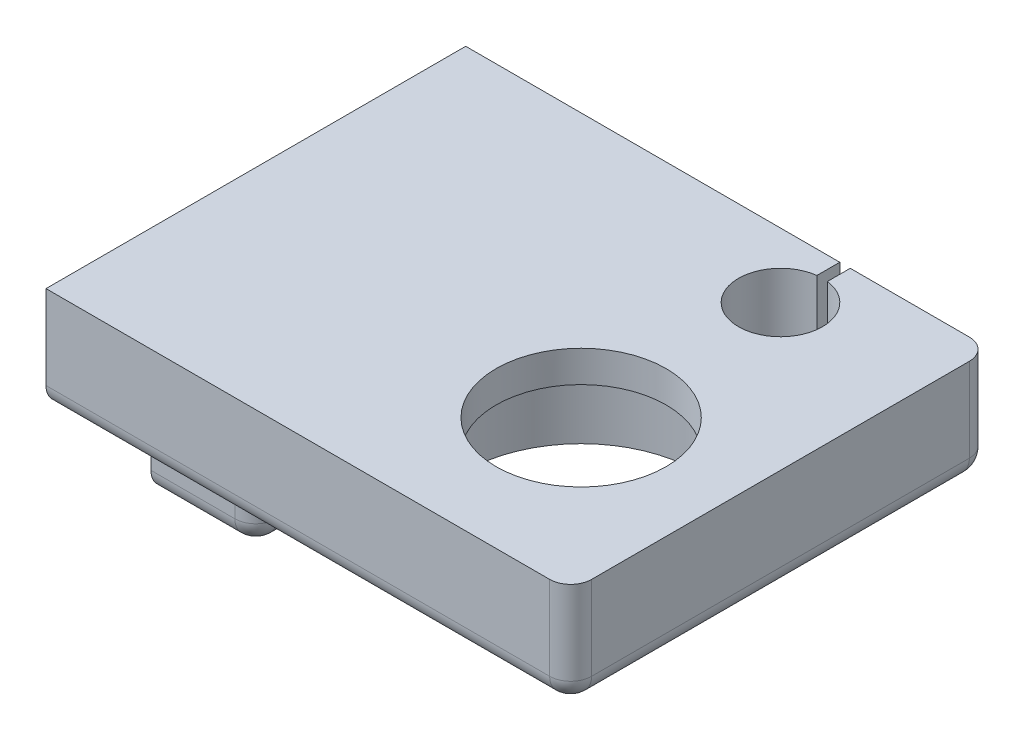
from build123d import *

# Parameters (mm, degrees)
BOSS_EXTRUDE1_DEPTH = 10
SKETCH3_R           = 11.1
SKETCH3_R_2         = 8.1
CUT_EXTRUDE1_DEPTH  = 7
SKETCH6_W           = 10
SKETCH6_H           = 12
BOSS_EXTRUDE4_DEPTH = 30
SKETCH7_R           = 2.8
CUT_EXTRUDE2_DEPTH  = 58.827329179
SKETCH8_R           = 4.3
CUT_EXTRUDE3_DEPTH  = 6
FILLET1_R           = 2


with BuildPart() as part:
    # Sketch2 → Boss-Extrude1 (new body)
    with BuildSketch(Plane(origin=(0, 0, 0), x_dir=(1, 0, 0), z_dir=(0, 1, 0))):
        with BuildLine():
            Line((35.65, 0), (0, 0))
            Line((0, 0), (0, -40))
            Line((0, -40), (35.65, -40))
            Line((35.65, -40), (36.65, -40))
            Line((36.65, -40), (50, -40))
            Line((50, -40), (50, 0))
            Line((50, 0), (36.65, 0))
            Line((36.65, 0), (36.65, -2.181373033))
            ThreePointArc((36.65, -2.181373033), (39.15, -3.504248689), (40.15, -6.15))
            ThreePointArc((40.15, -6.15), (33.504248689, -9.15), (35.65, -2.181373033))
            Line((35.65, -2.181373033), (35.65, 0))
        make_face()
        with BuildLine():
            ThreePointArc((36.65, -33.234553173), (36.15, -33.25), (35.65, -33.234553173))
            ThreePointArc((35.65, -33.234553173), (30.602027397, -19.248305328), (44.25, -25.15))
            ThreePointArc((44.25, -25.15), (42.051694672, -30.697972603), (36.65, -33.234553173))
        make_face(mode=Mode.SUBTRACT)
    extrude(amount=BOSS_EXTRUDE1_DEPTH)

    # Sketch3 → Cut-Extrude1 (cut)
    with BuildSketch(Plane.XZ):
        with Locations((36.15, 25.15)):
            Circle(SKETCH3_R)
        with Locations((36.15, 25.15)):
            Circle(SKETCH3_R_2, mode=Mode.SUBTRACT)
    extrude(amount=-CUT_EXTRUDE1_DEPTH, mode=Mode.SUBTRACT)

    # Sketch6 → Boss-Extrude4 (add)
    with BuildSketch(Plane(origin=(0, 0, 0), x_dir=(-1, 0, 0), z_dir=(0, 0, -1))):
        with Locations((-5, -6)):
            Rectangle(SKETCH6_W, SKETCH6_H)
    extrude(amount=-BOSS_EXTRUDE4_DEPTH)

    # Sketch7 → Cut-Extrude2 (cut, through all)
    with BuildSketch(Plane(origin=(10, 0, 0), x_dir=(0, 0, -1), z_dir=(1, 0, 0))):
        with Locations((-9, -5)):
            Circle(SKETCH7_R)
        with Locations((-21, -5)):
            Circle(SKETCH7_R)
    extrude(amount=-CUT_EXTRUDE2_DEPTH, mode=Mode.SUBTRACT)

    # Sketch8 → Cut-Extrude3 (cut)
    with BuildSketch(Plane(origin=(10, 0, 0), x_dir=(0, 0, -1), z_dir=(1, 0, 0))):
        with Locations((-21, -5)):
            Circle(SKETCH8_R)
        with Locations((-9, -5)):
            Circle(SKETCH8_R)
    extrude(amount=-CUT_EXTRUDE3_DEPTH, mode=Mode.SUBTRACT)

    # Fillet1
    fillet1_edges = [part.edges().sort_by_distance(p)[0] for p in [
        (10, -6, 30),
        (25, 0, 40),
        (50, 5, 40),
        (50, 0, 20),
        (43.325, 0, 0),
        (10, -6, 0),
        (22.825, 0, 0),
        (50, 5, 0),
        (5, -12, 30),
        (5, -12, 0),
        (10, -12, 15),
    ]]
    fillet(fillet1_edges, radius=FILLET1_R)


solid = part.part
